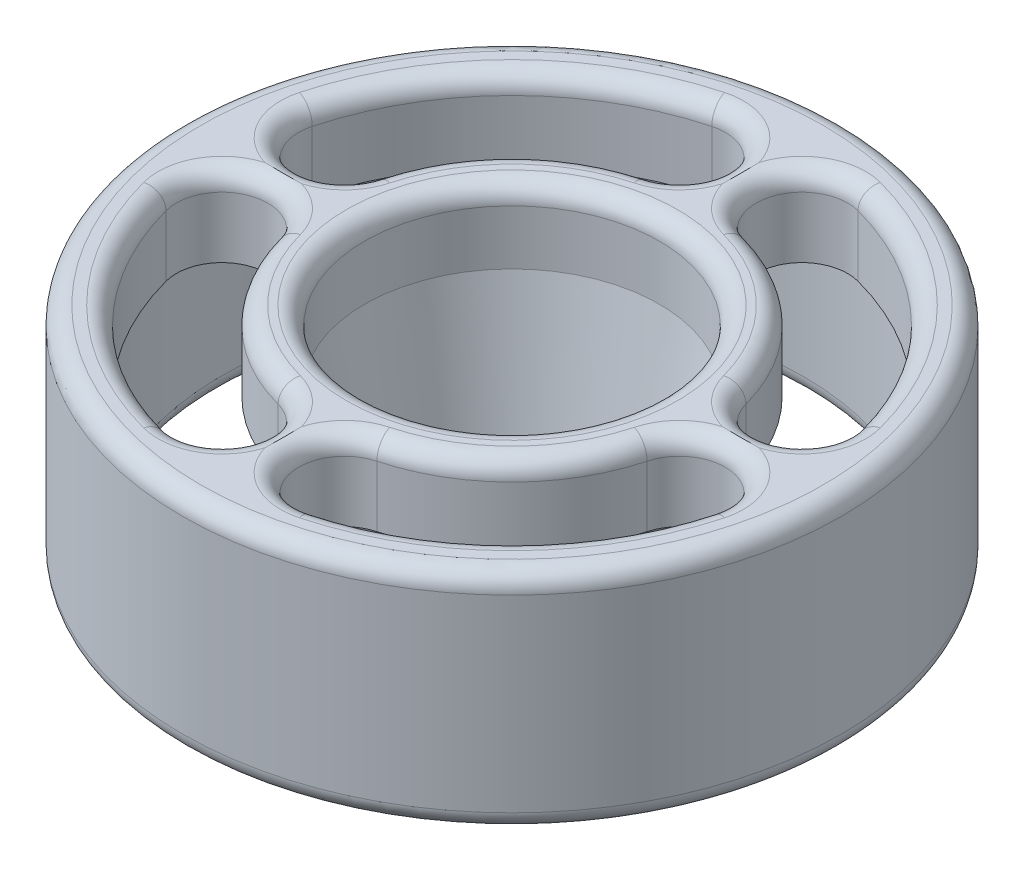
from build123d import *

# Parameters (mm, degrees)
CROQUIS2_R            = 1.125
CORTAR_EXTRUIR1_DEPTH = 29.259217191932034
CORTAR_EXTRUIR3_DEPTH = 12
REDONDEO1_R           = 1
REDONDEO2_R           = 1


with BuildPart() as part:
    # Croquis1 → Revolución1 (revolve)
    with BuildSketch(Plane(origin=(0, 0, 0), x_dir=(0, 0, -1), z_dir=(1, 0, 0))):
        Polygon((-6.680588596005596, 2), (-8.091204441673344, 10), (-8.091204441673344, 14), (-18.091204441673344, 13.999999999999998), (-18.09120444167334, -2.7500000000000018), (-3.2499999999999996, -2.75), (-3.25, 0), (0, 0), (-3.49e-15, 2.000000000004775), align=None)
    revolve(axis=Axis((0, 2.000000000004775, 3.49e-15), (0, -1, -1.75e-15)))

    # Croquis2 → Cortar-Extruir1 (cut, through all)
    with BuildSketch(Plane(origin=(0, 2.0000000000023936, 3.49e-15), x_dir=(1, 0, 0), z_dir=(0, 1, 1.75e-15))):
        with Locations(Location((0, 0, 0), (0, 0, 270))):
            Circle(CROQUIS2_R)
    extrude(amount=-CORTAR_EXTRUIR1_DEPTH, mode=Mode.SUBTRACT)

    # Croquis3 → Cortar-Revolución1 (revolve, cut)
    with BuildSketch(Plane(origin=(0, 0, 0), x_dir=(0, 0, -1), z_dir=(1, 0, 0)), mode=Mode.PRIVATE) as cortar_revoluci_n1_sk:
        Polygon((-15.956721408435095, -4.349286623479993), (-15.956721408435095, 9.650713376520008), (-9.956721408435095, 9.650713376520008), (-7.956721408435095, -4.349286623479992), align=None)
    revolve(cortar_revoluci_n1_sk.sketch.rotate(Axis((0, -1000, -3.49148e-12), (0, 1, 3.49e-15)), 180), axis=Axis((0, -1000, -3.49148e-12), (0, 1, 3.49e-15)), mode=Mode.SUBTRACT)

    # Croquis5 → Cortar-Extruir3 (cut)
    with BuildSketch(Plane(origin=(0, 14.000000000000021, 2.444e-14), x_dir=(1, 0, 0), z_dir=(0, 1, 1.75e-15))):
        with BuildLine():
            ThreePointArc((14.983492338128682, 4.014814671795773), (10.9686776663285, 10.968677666328498), (4.014814671795773, 14.983492338128682))
            ThreePointArc((4.014814671795773, 14.983492338128682), (0.9381909899598497, 13.207202827224593), (2.714480500863938, 10.13057914538867))
            ThreePointArc((2.714480500863938, 10.13057914538867), (7.416098644521734, 7.416098644521732), (10.13057914538867, 2.714480500863938))
            ThreePointArc((10.13057914538867, 2.714480500863938), (13.207202827224593, 0.9381909899598493), (14.983492338128682, 4.014814671795773))
        make_face()
        with BuildLine():
            ThreePointArc((4.014814671795721, -14.983492338128697), (10.968677666328434, -10.968677666328524), (14.983492338128668, -4.014814671795825))
            ThreePointArc((14.983492338128668, -4.014814671795825), (13.20720282722459, -0.9381909899598955), (10.130579145388662, -2.7144805008639734))
            ThreePointArc((10.130579145388662, -2.7144805008639734), (7.4160986445216786, -7.416098644521746), (2.7144805008639024, -10.13057914538868))
            ThreePointArc((2.7144805008639024, -10.13057914538868), (0.9381909899598018, -13.207202827224597), (4.014814671795721, -14.983492338128697))
        make_face()
        with BuildLine():
            ThreePointArc((-14.98349233812871, -4.014814671795668), (-10.96867766632859, -10.968677666328437), (-4.014814671795878, -14.983492338128654))
            ThreePointArc((-4.014814671795878, -14.983492338128654), (-0.9381909899599408, -13.207202827224586), (-2.7144805008640085, -10.130579145388651))
            ThreePointArc((-2.7144805008640085, -10.130579145388651), (-7.416098644521799, -7.416098644521696), (-10.13057914538869, -2.7144805008638673))
            ThreePointArc((-10.13057914538869, -2.7144805008638673), (-13.207202827224602, -0.9381909899597565), (-14.98349233812871, -4.014814671795668))
        make_face()
        with BuildLine():
            ThreePointArc((-4.014814671795616, 14.983492338128723), (-10.968677666328427, 10.96867766632864), (-14.983492338128642, 4.01481467179593))
            ThreePointArc((-14.983492338128642, 4.01481467179593), (-13.207202827224584, 0.938190989959987), (-10.130579145388642, 2.7144805008640445))
            ThreePointArc((-10.130579145388642, 2.7144805008640445), (-7.416098644521696, 7.416098644521837), (-2.7144805008638317, 10.130579145388698))
            ThreePointArc((-2.7144805008638317, 10.130579145388698), (-0.9381909899597112, 13.207202827224602), (-4.014814671795616, 14.983492338128723))
        make_face()
    extrude(amount=-CORTAR_EXTRUIR3_DEPTH, mode=Mode.SUBTRACT)

    # Redondeo1
    # the kernel refuses this fillet: 1 mm, written as the material it takes off along each edge
    with BuildSketch(Plane(origin=(0, -2.74999999999997, -9.6e-15), x_dir=(1.2e-16, 3.47e-15, -1), z_dir=(-1, 0, -1.2e-16))) as redondeo1_piece_1:
        with BuildLine():
            CenterArc((8.185190926075093 - REDONDEO1_R * 0.867295401695, -REDONDEO1_R), REDONDEO1_R, 8.130102354154952, 81.86989764584513)
            Line((8.185190926075093 + REDONDEO1_R * 0.122654091966, -REDONDEO1_R * 0.858578643763), (8.185190926075093, 0))
            Line((8.185190926075093, 0), (8.185190926075093 - REDONDEO1_R * 0.867295401695, 1.253e-14))
        make_face()
    revolve(axis=Axis((0, -2.74999999999997, -9.6e-15), (0, -1, -3.49e-15)), mode=Mode.SUBTRACT)
    with BuildSketch(Plane(origin=(12.557035741758677, 14.000000000000027, -3.364647586329831), x_dir=(-0.9659258262891276, 0, 0.25881904510229936), z_dir=(-0.25881904510229936, 1.6862559986094765e-15, -0.9659258262891276))) as redondeo1_piece_2:
        with BuildLine():
            CenterArc((2.512052717020636 + REDONDEO1_R, -REDONDEO1_R), REDONDEO1_R, 89.99999999999997, 89.99999999999963)
            Line((2.5120527170206355, -REDONDEO1_R), (2.512052717020636, 0))
            Line((2.512052717020636, 0), (2.512052717020636 + REDONDEO1_R, -8.88e-15))
        make_face()
    revolve(axis=Axis((12.557035741758677, 14.000000000000027, -3.364647586329831), (0, 1, 1.75e-15)), revolution_arc=180, mode=Mode.SUBTRACT)
    with BuildSketch(Plane(origin=(-5.551e-14, 14.000000000000021, 7.862e-14), x_dir=(0.9659258262891277, 0, -0.2588190451022993), z_dir=(0.2588190451022993, -1.6862559986094767e-15, 0.9659258262891277))) as redondeo1_piece_3:
        with BuildLine():
            CenterArc((15.512052717020714 + REDONDEO1_R, -REDONDEO1_R), REDONDEO1_R, 90, 89.99999999999957)
            Line((15.512052717020714, -REDONDEO1_R), (15.512052717020714, 0))
            Line((15.512052717020714, 0), (15.512052717020714 + REDONDEO1_R, -7.56e-15))
        make_face()
    revolve(axis=Axis((-5.551e-14, 14.000000000000021, 7.862e-14), (0, 1, 1.75e-15)), revolution_arc=60.00000000002627, mode=Mode.SUBTRACT)
    with BuildSketch(Plane(origin=(3.3646475863298555, 14.000000000000043, -12.557035741758652), x_dir=(0.25881904510229936, 2.1214007501089294e-15, -0.9659258262891276), z_dir=(0.9659258262891276, 0, 0.25881904510229936))) as redondeo1_piece_4:
        with BuildLine():
            CenterArc((2.512052717020636 + REDONDEO1_R, -REDONDEO1_R), REDONDEO1_R, 89.99999999999997, 89.99999999999972)
            Line((2.5120527170206355, -REDONDEO1_R), (2.512052717020636, 0))
            Line((2.512052717020636, 0), (2.512052717020636 + REDONDEO1_R, -7.45e-15))
        make_face()
    revolve(axis=Axis((3.3646475863298555, 14.000000000000043, -12.557035741758652), (0, 1, 1.75e-15)), revolution_arc=180, mode=Mode.SUBTRACT)
    with BuildSketch(Plane(origin=(-5.462e-14, 14.000000000000021, 7.818e-14), x_dir=(0.25881904510229936, 1.693712593581629e-15, -0.9659258262891276), z_dir=(-0.9659258262891276, 0, -0.25881904510229936))) as redondeo1_piece_5:
        with BuildLine():
            CenterArc((10.48794728297944 - REDONDEO1_R, REDONDEO1_R), REDONDEO1_R, 270, 89.99999999999959)
            Line((10.48794728297944, REDONDEO1_R), (10.48794728297944, 0))
            Line((10.48794728297944, 0), (10.48794728297944 - REDONDEO1_R, 7.19e-15))
        make_face()
    revolve(axis=Axis((-5.462e-14, 14.000000000000021, 7.818e-14), (0, -1, -1.75e-15)), revolution_arc=60.00000000002628, mode=Mode.SUBTRACT)
    with BuildSketch(Plane(origin=(3.36464758632981, 14, 12.557035741758714), x_dir=(-0.25881904510229536, 1.4142671667392858e-15, -0.9659258262891287), z_dir=(0.9659258262891287, 0, -0.25881904510229536))) as redondeo1_piece_6:
        with BuildLine():
            CenterArc((2.512052717020637 + REDONDEO1_R, -REDONDEO1_R), REDONDEO1_R, 90.00000000000003, 89.9999999999996)
            Line((2.5120527170206373, -REDONDEO1_R), (2.512052717020637, 0))
            Line((2.512052717020637, 0), (2.512052717020637 + REDONDEO1_R, -6.74e-15))
        make_face()
    revolve(axis=Axis((3.36464758632981, 14, 12.557035741758714), (0, 1, 1.75e-15)), revolution_arc=180.00000000000009, mode=Mode.SUBTRACT)
    with BuildSketch(Plane(origin=(-2.0339e-13, 14.000000000000021, -1.7762e-13), x_dir=(0.2588190451023025, -1.7177193165264736e-15, 0.9659258262891268), z_dir=(-0.9659258262891268, 0, 0.2588190451023025))) as redondeo1_piece_7:
        with BuildLine():
            CenterArc((15.512052717020895 + REDONDEO1_R, -REDONDEO1_R), REDONDEO1_R, 90, 89.9999999999996)
            Line((15.512052717020895, -REDONDEO1_R), (15.512052717020895, 0))
            Line((15.512052717020895, 0), (15.512052717020895 + REDONDEO1_R, -7.16e-15))
        make_face()
    revolve(axis=Axis((-2.0339e-13, 14.000000000000021, -1.7762e-13), (0, 1, 1.75e-15)), revolution_arc=60.0000000000255, mode=Mode.SUBTRACT)
    with BuildSketch(Plane(origin=(12.557035741758664, 14.000000000000016, 3.3646475863299234), x_dir=(0.9659258262891267, 0, 0.2588190451023027), z_dir=(-0.2588190451023027, -1.6862559986094747e-15, 0.9659258262891267))) as redondeo1_piece_8:
        with BuildLine():
            CenterArc((2.5120527170206364 + REDONDEO1_R, -REDONDEO1_R), REDONDEO1_R, 90.00000000000003, 89.9999999999996)
            Line((2.512052717020637, -REDONDEO1_R), (2.5120527170206364, 0))
            Line((2.5120527170206364, 0), (2.5120527170206364 + REDONDEO1_R, -6.4e-15))
        make_face()
    revolve(axis=Axis((12.557035741758664, 14.000000000000016, 3.3646475863299234), (0, 1, 1.75e-15)), revolution_arc=180, mode=Mode.SUBTRACT)
    with BuildSketch(Plane(origin=(-2.0961e-13, 14.000000000000021, -1.865e-13), x_dir=(0.965925826289124, 0, 0.25881904510231285), z_dir=(0.25881904510231285, 1.6862559986094702e-15, -0.965925826289124))) as redondeo1_piece_9:
        with BuildLine():
            CenterArc((10.48794728297963 - REDONDEO1_R, REDONDEO1_R), REDONDEO1_R, 270, 89.99999999999966)
            Line((10.48794728297963, REDONDEO1_R), (10.48794728297963, 0))
            Line((10.48794728297963, 0), (10.48794728297963 - REDONDEO1_R, 5.84e-15))
        make_face()
    revolve(axis=Axis((-2.0961e-13, 14.000000000000021, -1.865e-13), (0, -1, -1.75e-15)), revolution_arc=60.00000000002507, mode=Mode.SUBTRACT)
    with BuildSketch(Plane(origin=(-12.557035741758702, 14.000000000000016, 3.36464758632979), x_dir=(0.9659258262891296, 0, -0.2588190451022917), z_dir=(0.2588190451022917, -1.68625599860948e-15, 0.9659258262891296))) as redondeo1_piece_10:
        with BuildLine():
            CenterArc((2.512052717020636 + REDONDEO1_R, -REDONDEO1_R), REDONDEO1_R, 90.00000000000003, 89.99999999999957)
            Line((2.512052717020636, -REDONDEO1_R), (2.512052717020636, 0))
            Line((2.512052717020636, 0), (2.512052717020636 + REDONDEO1_R, -5.33e-15))
        make_face()
    revolve(axis=Axis((-12.557035741758702, 14.000000000000016, 3.36464758632979), (0, 1, 1.75e-15)), revolution_arc=180.0000000000001, mode=Mode.SUBTRACT)
    with BuildSketch(Plane(origin=(-5.329e-14, 14.000000000000021, 7.684e-14), x_dir=(-0.9659258262891307, 0, 0.25881904510228787), z_dir=(-0.25881904510228787, 1.6862559986094818e-15, -0.9659258262891307))) as redondeo1_piece_11:
        with BuildLine():
            CenterArc((15.51205271702058 + REDONDEO1_R, -REDONDEO1_R), REDONDEO1_R, 90, 89.99999999999963)
            Line((15.51205271702058, -REDONDEO1_R), (15.51205271702058, 0))
            Line((15.51205271702058, 0), (15.51205271702058 + REDONDEO1_R, -6.65e-15))
        make_face()
    revolve(axis=Axis((-5.329e-14, 14.000000000000021, 7.684e-14), (0, 1, 1.75e-15)), revolution_arc=60.00000000002684, mode=Mode.SUBTRACT)
    with BuildSketch(Plane(origin=(-3.3646475863299434, 14, 12.557035741758677), x_dir=(-0.25881904510230597, -2.1214007501089287e-15, 0.9659258262891258), z_dir=(-0.9659258262891258, 0, -0.25881904510230597))) as redondeo1_piece_12:
        with BuildLine():
            CenterArc((2.512052717020637 + REDONDEO1_R, -REDONDEO1_R), REDONDEO1_R, 90.00000000000003, 89.99999999999949)
            Line((2.5120527170206373, -REDONDEO1_R), (2.512052717020637, 0))
            Line((2.512052717020637, 0), (2.512052717020637 + REDONDEO1_R, -6.76e-15))
        make_face()
    revolve(axis=Axis((-3.3646475863299434, 14, 12.557035741758677), (0, 1, 1.75e-15)), revolution_arc=179.99999999999997, mode=Mode.SUBTRACT)
    with BuildSketch(Plane(origin=(-5.951e-14, 14.000000000000021, 8.128e-14), x_dir=(-0.25881904510229853, -1.6937125935816514e-15, 0.9659258262891278), z_dir=(0.9659258262891278, 0, 0.25881904510229853))) as redondeo1_piece_13:
        with BuildLine():
            CenterArc((10.4879472829793 - REDONDEO1_R, REDONDEO1_R), REDONDEO1_R, 270, 89.99999999999959)
            Line((10.4879472829793, REDONDEO1_R), (10.4879472829793, 0))
            Line((10.4879472829793, 0), (10.4879472829793 - REDONDEO1_R, 7.02e-15))
        make_face()
    revolve(axis=Axis((-5.951e-14, 14.000000000000021, 8.128e-14), (0, -1, -1.75e-15)), revolution_arc=60.00000000002714, mode=Mode.SUBTRACT)
    with BuildSketch(Plane(origin=(0, 14.000000000000014, 2.444e-14), x_dir=(0, -1.76e-15, 1), z_dir=(1, 0, 0))) as redondeo1_piece_14:
        with BuildLine():
            CenterArc((8.09120444167332 + REDONDEO1_R, REDONDEO1_R), REDONDEO1_R, 180, 89.9999999999996)
            Line((8.09120444167332 + REDONDEO1_R, 2e-17), (8.09120444167332, 0))
            Line((8.09120444167332, 0), (8.091204441673327, REDONDEO1_R))
        make_face()
    revolve(axis=Axis((0, 14.000000000000014, 2.444e-14), (0, -1, -1.75e-15)), mode=Mode.SUBTRACT)
    with BuildSketch(Plane(origin=(-3.364647586329724, 14.000000000000043, -12.557035741758686), x_dir=(0.25881904510228926, -1.414267166739286e-15, 0.9659258262891303), z_dir=(-0.9659258262891303, 0, 0.25881904510228926))) as redondeo1_piece_15:
        with BuildLine():
            CenterArc((2.512052717020636 + REDONDEO1_R, -REDONDEO1_R), REDONDEO1_R, 89.99999999999997, 89.99999999999963)
            Line((2.5120527170206355, -REDONDEO1_R), (2.512052717020636, 0))
            Line((2.512052717020636, 0), (2.512052717020636 + REDONDEO1_R, -7.47e-15))
        make_face()
    revolve(axis=Axis((-3.364647586329724, 14.000000000000043, -12.557035741758686), (0, 1, 1.75e-15)), revolution_arc=180, mode=Mode.SUBTRACT)
    with BuildSketch(Plane(origin=(-2.0384e-13, 14.000000000000021, -1.7762e-13), x_dir=(-0.2588190451022777, 1.7177193165265286e-15, -0.9659258262891334), z_dir=(0.9659258262891334, 0, -0.2588190451022777))) as redondeo1_piece_16:
        with BuildLine():
            CenterArc((15.512052717020396 + REDONDEO1_R, -REDONDEO1_R), REDONDEO1_R, 90, 89.9999999999996)
            Line((15.512052717020396, -REDONDEO1_R), (15.512052717020396, 0))
            Line((15.512052717020396, 0), (15.512052717020396 + REDONDEO1_R, -7.05e-15))
        make_face()
    revolve(axis=Axis((-2.0384e-13, 14.000000000000021, -1.7762e-13), (0, 1, 1.75e-15)), revolution_arc=60.00000000002762, mode=Mode.SUBTRACT)
    with BuildSketch(Plane(origin=(-12.557035741758643, 14.000000000000027, -3.3646475863299616), x_dir=(-0.9659258262891247, 0, -0.2588190451023098), z_dir=(0.2588190451023098, 1.6862559986094712e-15, -0.9659258262891247))) as redondeo1_piece_17:
        with BuildLine():
            CenterArc((2.512052717020636 + REDONDEO1_R, -REDONDEO1_R), REDONDEO1_R, 89.99999999999997, 89.9999999999996)
            Line((2.5120527170206355, -REDONDEO1_R), (2.512052717020636, 0))
            Line((2.512052717020636, 0), (2.512052717020636 + REDONDEO1_R, -7.81e-15))
        make_face()
    revolve(axis=Axis((-12.557035741758643, 14.000000000000027, -3.3646475863299616), (0, 1, 1.75e-15)), revolution_arc=180.00000000000009, mode=Mode.SUBTRACT)
    with BuildSketch(Plane(origin=(-1.9496e-13, 14.000000000000021, -1.6741e-13), x_dir=(-0.9659258262891292, 0, -0.25881904510229353), z_dir=(-0.25881904510229353, -1.686255998609479e-15, 0.9659258262891292))) as redondeo1_piece_18:
        with BuildLine():
            CenterArc((10.487947282979135 - REDONDEO1_R, REDONDEO1_R), REDONDEO1_R, 270, 89.99999999999952)
            Line((10.487947282979135, REDONDEO1_R), (10.487947282979135, 0))
            Line((10.487947282979135, 0), (10.487947282979135 - REDONDEO1_R, 8.37e-15))
        make_face()
    revolve(axis=Axis((-1.9496e-13, 14.000000000000021, -1.6741e-13), (0, -1, -1.75e-15)), revolution_arc=60.00000000002817, mode=Mode.SUBTRACT)
    with BuildSketch(Plane(origin=(0, 14.00000000000003, 2.444e-14), x_dir=(0, -1.77e-15, 1), z_dir=(1, 0, 0))) as redondeo1_piece_19:
        with BuildLine():
            CenterArc((18.09120444167332 - REDONDEO1_R, REDONDEO1_R), REDONDEO1_R, 270, 89.99999999999909)
            Line((18.09120444167332, REDONDEO1_R), (18.09120444167332, 0))
            Line((18.09120444167332, 0), (18.09120444167332 - REDONDEO1_R, 1.598e-14))
        make_face()
    revolve(axis=Axis((0, 14.00000000000003, 2.444e-14), (0, -1, -1.75e-15)), mode=Mode.SUBTRACT)
    with BuildSketch(Plane(origin=(0, -2.7499999999999947, -4.8e-15), x_dir=(0, -1.78e-15, 1), z_dir=(1, 0, 0))) as redondeo1_piece_20:
        with BuildLine():
            CenterArc((3.2500000000000044 + REDONDEO1_R, -REDONDEO1_R), REDONDEO1_R, 90.00000000000006, 89.99999999999994)
            Line((3.2500000000000044 + REDONDEO1_R, 0), (3.2500000000000044, 0))
            Line((3.2500000000000044, 0), (3.250000000000005, -REDONDEO1_R))
        make_face()
    revolve(axis=Axis((0, -2.7499999999999947, -4.8e-15), (0, -1, -1.75e-15)), mode=Mode.SUBTRACT)

    # Croquis6 → Cortar-Revolución2 (revolve, cut)
    with BuildSketch(Plane(origin=(0, 0, 0), x_dir=(0, 0, -1), z_dir=(1, 0, 0)), mode=Mode.PRIVATE) as cortar_revoluci_n2_sk:
        Polygon((-18.091204441673817, -4.3492866234800145), (-15.956721408463517, -4.3492866234800145), (-15.956721408463517, 1.6507133765199862), (-18.091204441673355, 1.650713376519986), align=None)
    revolve(cortar_revoluci_n2_sk.sketch.rotate(Axis((0, -1000, -3.49148e-12), (0, 1, 3.49e-15)), 180), axis=Axis((0, -1000, -3.49148e-12), (0, 1, 3.49e-15)), mode=Mode.SUBTRACT)

    # Redondeo2
    redondeo2_edges = [part.edges().sort_by_distance(p)[0] for p in [
        (4.87e-15, 1.6507133765200654, -18.091204441673344),
        (-3.91e-15, 1.6507133765200603, 15.956721408463517),
    ]]
    fillet(redondeo2_edges, radius=REDONDEO2_R)


solid = part.part
